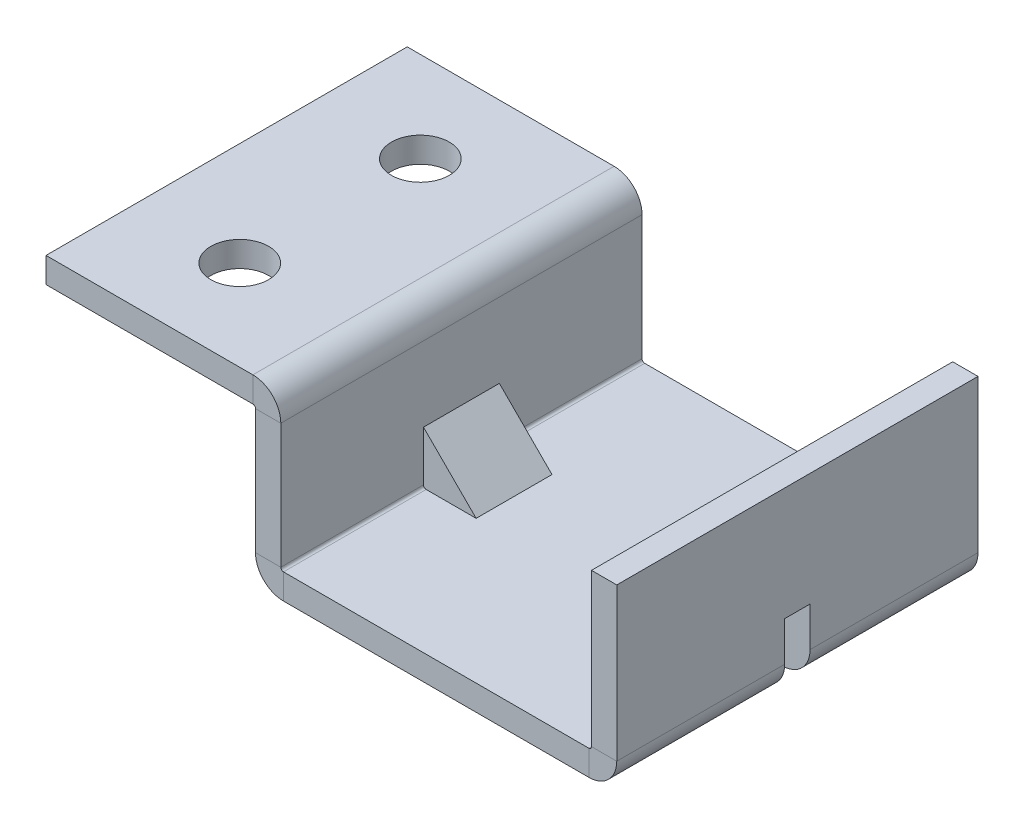
from build123d import *

# Parameters (mm, degrees)
SKETCH1_W                      = 100
SKETCH1_H                      = 100
BASE_FLANGE1_DEPTH             = 7
EDGE_FLANGE1_STRIP_W           = 29.4732
EDGE_FLANGE1_STRIP_H           = 7
EDGE_FLANGE1_STRIP_CUT_DEPTH   = 100
EDGE_FLANGE1_STRIP_2_W         = 29.4732
EDGE_FLANGE1_STRIP_2_H         = 7
EDGE_FLANGE1_STRIP_CUT_2_DEPTH = 100
EDGE_FLANGE1_DEPTH             = 100
EDGE_FLANGE1_BEND_DEPTH        = 100
SHEET_START                    = -3.5
SHEET_METAL_GUSSET13_DEPTH     = 7
SHEET_START_2                  = -10.5
SHEET_METAL_GUSSET13_2_DEPTH   = 21
SHEET_METAL_GUSSET13_3_DEPTH   = 7
SHEET_START_3                  = 3.5
SHEET_METAL_GUSSET13_4_DEPTH   = 7
SHEET_METAL_GUSSET14_DEPTH     = 7
SHEET_METAL_GUSSET14_2_DEPTH   = 21
SHEET_METAL_GUSSET14_3_DEPTH   = 7
SHEET_METAL_GUSSET14_4_DEPTH   = 7
EDGE_FLANGE3_STRIP_W           = 29.4732
EDGE_FLANGE3_STRIP_H           = 7
EDGE_FLANGE3_STRIP_CUT_DEPTH   = 100
EDGE_FLANGE3_DEPTH             = 100
F_16_0MM_DOWEL_HOLE1_D         = 16


# Read off the part's stored shape, not the designer's step: Sheet Metal Gusset13, Sheet Metal Gusset14
# Sheet-metal steps are written as plain solids
with BuildPart() as part:
    # Sketch1 → Base-Flange1 (new body)
    with BuildSketch(Plane(origin=(0, 0, 0), x_dir=(1, 0, 0), z_dir=(0, 1, 0))):
        Rectangle(SKETCH1_W, SKETCH1_H)
    extrude(amount=-BASE_FLANGE1_DEPTH)

    # Edge-Flange1 strip (across the edge) → Edge-Flange1 strip cut (cut)
    with BuildSketch(Plane(origin=(-50, 0, -50), x_dir=(1, 0, 0), z_dir=(0, 0, 1))):
        with Locations((-7, -3.5)):
            Rectangle(EDGE_FLANGE1_STRIP_W, EDGE_FLANGE1_STRIP_H)
    extrude(amount=EDGE_FLANGE1_STRIP_CUT_DEPTH, mode=Mode.SUBTRACT)

    # Edge-Flange1 strip 2 (across the edge) → Edge-Flange1 strip cut 2 (cut)
    with BuildSketch(Plane(origin=(50, 0, 50), x_dir=(-1, 0, 0), z_dir=(0, 0, -1))):
        with Locations((-7, -3.5)):
            Rectangle(EDGE_FLANGE1_STRIP_2_W, EDGE_FLANGE1_STRIP_2_H)
    extrude(amount=EDGE_FLANGE1_STRIP_CUT_2_DEPTH, mode=Mode.SUBTRACT)

    # Edge-Flange1 section (across the edge) → Edge-Flange1 (add)
    with BuildSketch(Plane(origin=(-50, 0, -50), x_dir=(1, 0, 0), z_dir=(0, 0, 1))):
        with BuildLine():
            Line((0, 0.7366), (0, 43))
            Line((0, 43), (7, 43))
            Line((7, 43), (7, 0.7366))
            ThreePointArc((7, 0.7366), (7.215745145, 0.215745145), (7.7366, 0))
            Line((7.7366, 0), (7.7366, -7))
            ThreePointArc((7.7366, -7), (2.265997677, -4.734002323), (0, 0.7366))
        make_face()
    extrude(amount=EDGE_FLANGE1_DEPTH)

    # Edge-Flange1 section 2 (across the edge) → Edge-Flange1 bend (add)
    with BuildSketch(Plane(origin=(50, 0, 50), x_dir=(-1, 0, 0), z_dir=(0, 0, -1))):
        with BuildLine():
            Line((0, 0.7366), (0, 43))
            Line((0, 43), (7, 43))
            Line((7, 43), (7, 0.7366))
            ThreePointArc((7, 0.7366), (7.215745145, 0.215745145), (7.7366, 0))
            Line((7.7366, 0), (7.7366, -7))
            ThreePointArc((7.7366, -7), (2.265997677, -4.734002323), (0, 0.7366))
        make_face()
    extrude(amount=EDGE_FLANGE1_BEND_DEPTH)

    # Sheet Metal Gusset13 outline → Sheet Metal Gusset13 (cut)
    with BuildSketch(Plane.XY.offset(SHEET_START)):
        with BuildLine():
            Line((42.2634, 0), (38.325869023, 0))
            Line((38.325869023, 0), (31.325869023, -7))
            Line((31.325869023, -7), (42.2634, -7))
            ThreePointArc((42.2634, -7), (47.734002323, -4.734002323), (50, 0.7366))
            Line((50, 0.7366), (50, 11.674130977))
            Line((50, 11.674130977), (43, 4.674130977))
            Line((43, 4.674130977), (43, 0.7366))
            ThreePointArc((43, 0.7366), (42.784254855, 0.215745145), (42.2634, 0))
        make_face()
    extrude(amount=SHEET_METAL_GUSSET13_DEPTH, mode=Mode.SUBTRACT)

    # Sheet Metal Gusset13 2 outline → Sheet Metal Gusset13 2 (add)
    with BuildSketch(Plane.XY.offset(SHEET_START_2)):
        Polygon((43, 14.573625914), (28.426374086, 0), (38.325869023, 0), (43, 4.674130977), align=None)
    extrude(amount=SHEET_METAL_GUSSET13_2_DEPTH)

    # Sheet Metal Gusset13 3 outline → Sheet Metal Gusset13 3 (add)
    with BuildSketch(Plane.XY.offset(SHEET_START_2)):
        with BuildLine():
            Line((43, 4.674130977), (38.325869023, 0))
            Line((38.325869023, 0), (42.2634, 0))
            ThreePointArc((42.2634, 0), (42.784254855, 0.215745145), (43, 0.7366))
            Line((43, 0.7366), (43, 4.674130977))
        make_face()
    extrude(amount=SHEET_METAL_GUSSET13_3_DEPTH)

    # Sheet Metal Gusset13 4 outline → Sheet Metal Gusset13 4 (add)
    with BuildSketch(Plane.XY.offset(SHEET_START_3)):
        with BuildLine():
            Line((43, 4.674130977), (38.325869023, 0))
            Line((38.325869023, 0), (42.2634, 0))
            ThreePointArc((42.2634, 0), (42.784254855, 0.215745145), (43, 0.7366))
            Line((43, 0.7366), (43, 4.674130977))
        make_face()
    extrude(amount=SHEET_METAL_GUSSET13_4_DEPTH)

    # Sheet Metal Gusset14 outline → Sheet Metal Gusset14 (cut)
    with BuildSketch(Plane.XY.offset(SHEET_START)):
        with BuildLine():
            Line((-43, 0.7366), (-43, 4.674130977))
            Line((-43, 4.674130977), (-50, 11.674130977))
            Line((-50, 11.674130977), (-50, 0.7366))
            ThreePointArc((-50, 0.7366), (-47.734002323, -4.734002323), (-42.2634, -7))
            Line((-42.2634, -7), (-31.325869023, -7))
            Line((-31.325869023, -7), (-38.325869023, 0))
            Line((-38.325869023, 0), (-42.2634, 0))
            ThreePointArc((-42.2634, 0), (-42.784254855, 0.215745145), (-43, 0.7366))
        make_face()
    extrude(amount=SHEET_METAL_GUSSET14_DEPTH, mode=Mode.SUBTRACT)

    # Sheet Metal Gusset14 2 outline → Sheet Metal Gusset14 2 (add)
    with BuildSketch(Plane.XY.offset(SHEET_START_2)):
        Polygon((-28.426374086, 0), (-43, 14.573625914), (-43, 4.674130977), (-38.325869023, 0), align=None)
    extrude(amount=SHEET_METAL_GUSSET14_2_DEPTH)

    # Sheet Metal Gusset14 3 outline → Sheet Metal Gusset14 3 (add)
    with BuildSketch(Plane.XY.offset(SHEET_START_2)):
        with BuildLine():
            Line((-38.325869023, 0), (-43, 4.674130977))
            Line((-43, 4.674130977), (-43, 0.7366))
            ThreePointArc((-43, 0.7366), (-42.784254855, 0.215745145), (-42.2634, 0))
            Line((-42.2634, 0), (-38.325869023, 0))
        make_face()
    extrude(amount=SHEET_METAL_GUSSET14_3_DEPTH)

    # Sheet Metal Gusset14 4 outline → Sheet Metal Gusset14 4 (add)
    with BuildSketch(Plane.XY.offset(SHEET_START_3)):
        with BuildLine():
            Line((-38.325869023, 0), (-43, 4.674130977))
            Line((-43, 4.674130977), (-43, 0.7366))
            ThreePointArc((-43, 0.7366), (-42.784254855, 0.215745145), (-42.2634, 0))
            Line((-42.2634, 0), (-38.325869023, 0))
        make_face()
    extrude(amount=SHEET_METAL_GUSSET14_4_DEPTH)

    # Edge-Flange3 strip (across the edge) → Edge-Flange3 strip cut (cut)
    with BuildSketch(Plane(origin=(-50, 43, 50), x_dir=(0, -1, 0), z_dir=(0, 0, -1))):
        with Locations((-7, -3.5)):
            Rectangle(EDGE_FLANGE3_STRIP_W, EDGE_FLANGE3_STRIP_H)
    extrude(amount=EDGE_FLANGE3_STRIP_CUT_DEPTH, mode=Mode.SUBTRACT)

    # Edge-Flange3 section (across the edge) → Edge-Flange3 (add)
    with BuildSketch(Plane(origin=(-50, 43, 50), x_dir=(0, -1, 0), z_dir=(0, 0, -1))):
        with BuildLine():
            Line((0, 0.7366), (0, 58))
            Line((0, 58), (7, 58))
            Line((7, 58), (7, 0.7366))
            ThreePointArc((7, 0.7366), (7.215745145, 0.215745145), (7.7366, 0))
            Line((7.7366, 0), (7.7366, -7))
            ThreePointArc((7.7366, -7), (2.265997677, -4.734002323), (0, 0.7366))
        make_face()
    extrude(amount=EDGE_FLANGE3_DEPTH)

    # Ø16.0mm Dowel Hole1 (through all)
    with Locations(Plane(origin=(0, 36, 0), x_dir=(-1, 0, 0), z_dir=(0, -1, 0))):
        with Locations((79.3683, -25), (79.3683, 25)):
            Hole(F_16_0MM_DOWEL_HOLE1_D / 2)


solid = part.part
